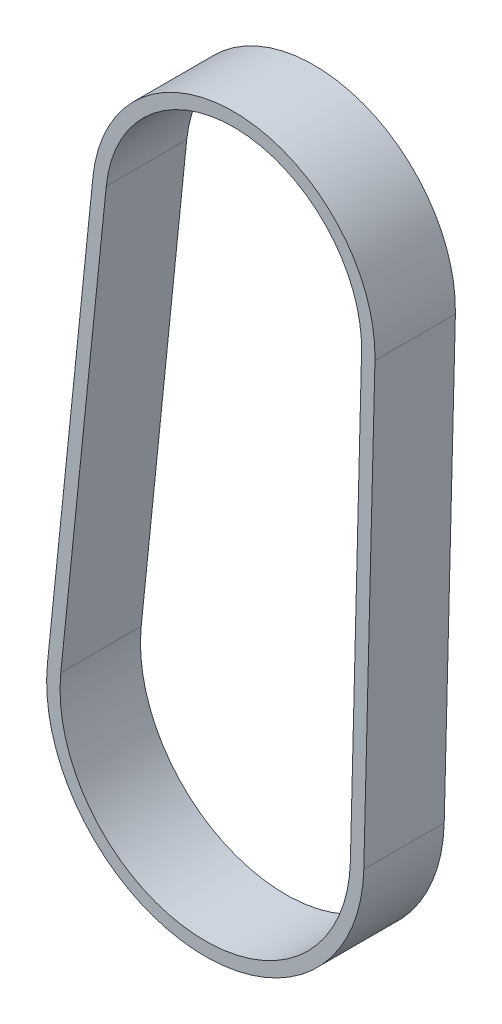
from build123d import *

# Parameters (mm, degrees)
EXTRUDE_THIN1_DEPTH = 9


with BuildPart() as part:
    # Sketch2 → Extrude-Thin1 (new body)
    with BuildSketch(Plane.XY):
        with BuildLine():
            Line((15.818995359, -0.395749097), (14.569448036, -50.343009774))
            ThreePointArc((14.569448036, -50.343009774), (-4.302125021, -67.613268616), (-20.832611838, -48.090432866))
            Line((-20.832611838, -48.090432866), (-15.741581769, 1.612400359))
            ThreePointArc((-15.741581769, 1.612400359), (1.004820519, 15.792009601), (15.818995359, -0.395749097))
        make_face()
        with BuildLine():
            Line((14.319464539, -0.358234833), (13.069917216, -50.30549551))
            ThreePointArc((13.069917216, -50.30549551), (-4.206875019, -66.116295858), (-19.340419288, -48.243277214))
            Line((-19.340419288, -48.243277214), (-14.249389219, 1.459556011))
            ThreePointArc((-14.249389219, 1.459556011), (0.909570517, 14.295036843), (14.319464539, -0.358234833))
        make_face(mode=Mode.SUBTRACT)
    extrude(amount=EXTRUDE_THIN1_DEPTH)


solid = part.part
